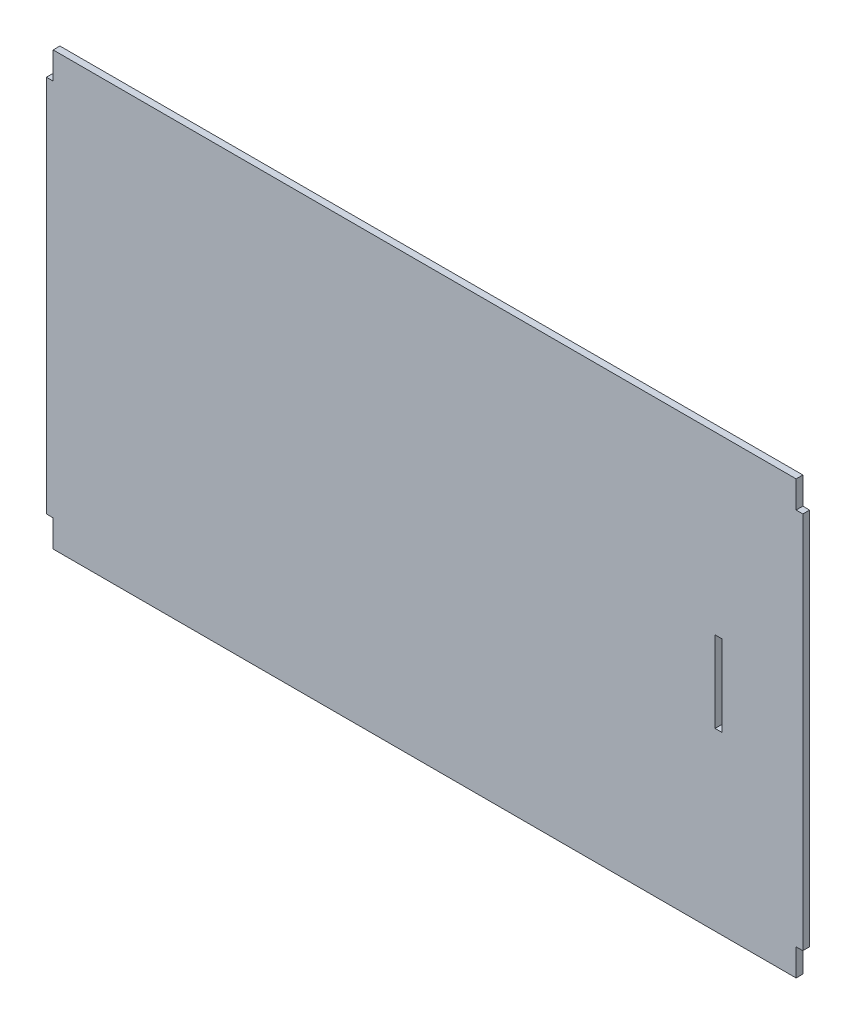
from build123d import *

# Parameters (mm, degrees)
SHELF_DEPTH              = 3.175
TILT_MOUNT_SLOT_SKETCH_W = 3.175
TILT_MOUNT_SLOT_SKETCH_H = 38.1
TILT_MOUNT_SLOT_DEPTH    = 410.575


with BuildPart() as part:
    # Sketch1 → Shelf (new body)
    with BuildSketch(Plane.XY):
        Polygon((3.175, 203.2), (3.175, 190.5), (0, 190.5), (0, 12.7), (3.175, 12.7), (3.175, 0), (352.425, 0), (352.425, 12.7), (355.6, 12.7), (355.6, 190.5), (352.425, 190.5), (352.425, 203.2), align=None)
    extrude(amount=SHELF_DEPTH)

    # Tilt mount slot sketch → Tilt Mount Slot (cut, through all)
    with BuildSketch(Plane.XY.offset(3.175)):
        with Locations((315.9125, 101.6)):
            Rectangle(TILT_MOUNT_SLOT_SKETCH_W, TILT_MOUNT_SLOT_SKETCH_H)
    extrude(amount=-TILT_MOUNT_SLOT_DEPTH, mode=Mode.SUBTRACT)


solid = part.part
